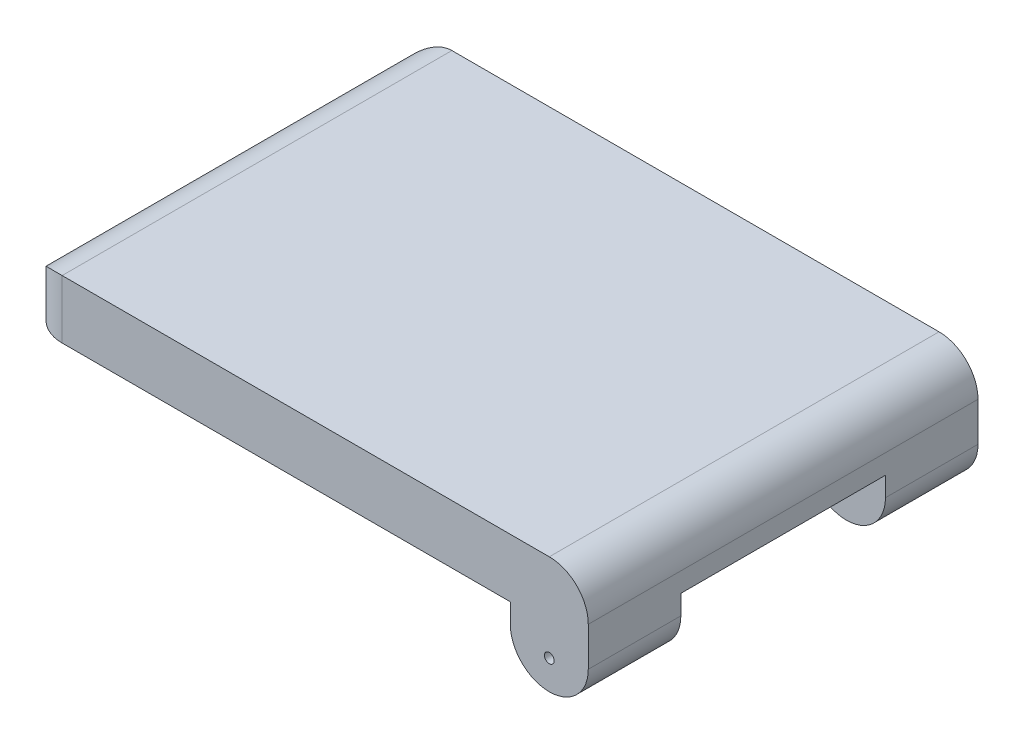
from build123d import *

# Parameters (mm, degrees)
SKETCH_5_W          = 58
SKETCH_5_H          = 40
EXTRUDE_3_DEPTH     = 6
SKETCH_6_W          = 8
SKETCH_6_H          = 9.5
EXTRUDE_4_DEPTH     = 6
CUT_EXTRUDE_2_REACH = 137.835
SKETCH_7_R          = 0.5
FILLET_4_R          = 4
FILLET_5_R          = 4


with BuildPart() as part:
    # Эскиз5 → Бобышка-Вытянуть3 (new body)
    with BuildSketch(Plane(origin=(0, 0, 0), x_dir=(1, 0, 0), z_dir=(0, 1, 0))):
        with Locations((-100.673147531, 130.465154765)):
            Rectangle(SKETCH_5_W, SKETCH_5_H)
    extrude(amount=EXTRUDE_3_DEPTH)

    # Эскиз6 → Бобышка-Вытянуть4 (add)
    with BuildSketch(Plane.XZ):
        with Locations((-75.673147531, -115.215154765)):
            Rectangle(SKETCH_6_W, SKETCH_6_H)
        with Locations((-75.673147531, -145.715154765)):
            Rectangle(SKETCH_6_W, SKETCH_6_H)
    extrude(amount=EXTRUDE_4_DEPTH)

    # Вырез-Вытянуть2: up to this face of the body (flat: up to its plane)
    cut_extrude_2_end = Plane(part.part.faces().sort_by_distance((-97.642844501, 2.272727273, -150.465154765))[0])
    # Эскиз7 → Вырез-Вытянуть2 (cut, up to the picked face)
    with BuildSketch(Plane.XY.offset(-110.465154765), mode=Mode.PRIVATE) as cut_extrude_2_sk1:
        with Locations((-75.673147531, -3)):
            Circle(SKETCH_7_R)
    cut_extrude_2_tool1 = split(extrude(cut_extrude_2_sk1.sketch, amount=-CUT_EXTRUDE_2_REACH, mode=Mode.PRIVATE), bisect_by=cut_extrude_2_end, keep=Keep.BOTH, mode=Mode.PRIVATE)
    add(cut_extrude_2_tool1.solids().sort_by(Axis((-75.673148, -3, -110.465155), (0, 0, -1)))[0], mode=Mode.SUBTRACT)

    # Скругление4
    fillet_4_edges = [part.edges().sort_by_distance(p)[0] for p in [
        (-71.673147531, 6, -130.465154765),
        (-71.673147531, -6, -145.715154765),
        (-79.673147531, -6, -145.715154765),
        (-71.673147531, -6, -115.215154765),
        (-79.673147531, -6, -115.215154765),
    ]]
    fillet(fillet_4_edges, radius=FILLET_4_R - 0.0001)  # a hair under: the kernel refuses the full size

    # Скругление5
    fillet_5_edges = [part.edges().sort_by_distance(p)[0] for p in [
        (-129.673147531, 6, -130.465154765),
        (-129.673147531, 3, -110.465154765),
        (-129.673147531, 3, -150.465154765),
    ]]
    fillet(fillet_5_edges, radius=FILLET_5_R)


solid = part.part
